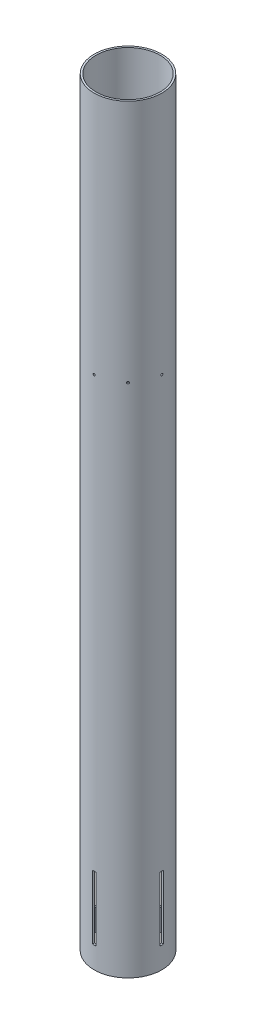
from build123d import *

# Parameters (mm, degrees)
SKETCH1_R                 = 53.721
SKETCH1_R_2               = 50.8
BODY_TUBE_EXTRUSION_DEPTH = 1206.5
ENGINE_BLOCK_HOLE_REACH   = 1214.465
SKETCH2_R                 = 1.6383
CIRPATTERN1_COUNT         = 8
CUT_EXTRUDE1_REACH        = 1214.465
SKETCH3_W                 = 5.334
SKETCH3_H                 = 101.6
CIRPATTERN2_COUNT         = 4


with BuildPart() as part:
    # Sketch1 → Body Tube Extrusion (new body)
    with BuildSketch(Plane(origin=(0, 0, 0), x_dir=(1, 0, 0), z_dir=(0, 1, 0))):
        Circle(SKETCH1_R)
        Circle(SKETCH1_R_2, mode=Mode.SUBTRACT)
    extrude(amount=BODY_TUBE_EXTRUSION_DEPTH)

    # Sketch2 → Engine Block Hole (cut, up to next)
    with BuildSketch(Plane.XY.offset(53.721), mode=Mode.PRIVATE) as engine_block_hole_sk1:
        with Locations((0, 819.15)):
            Circle(SKETCH2_R)
    engine_block_hole_tool1 = extrude(engine_block_hole_sk1.sketch, amount=-ENGINE_BLOCK_HOLE_REACH, mode=Mode.PRIVATE) & part.part
    engine_block_hole = engine_block_hole_tool1.solids().sort_by_distance((0, 819.15, 53.721))[0]
    add(engine_block_hole, mode=Mode.SUBTRACT)

    # CirPattern1: Engine Block Hole ×8 about axis
    cirpattern1_axis = Axis((0, 1206.5, 0), (0, -1, 0))
    for i in range(1, CIRPATTERN1_COUNT):
        add(engine_block_hole.rotate(cirpattern1_axis, i * 360 / CIRPATTERN1_COUNT), mode=Mode.SUBTRACT)

    # Sketch3 → Cut-Extrude1 (cut, up to next)
    with BuildSketch(Plane.XY.offset(53.721), mode=Mode.PRIVATE) as cut_extrude1_sk1:
        with Locations((0, 85.09)):
            Rectangle(SKETCH3_W, SKETCH3_H)
    cut_extrude1_tool1 = extrude(cut_extrude1_sk1.sketch, amount=-CUT_EXTRUDE1_REACH, mode=Mode.PRIVATE) & part.part
    cut_extrude1 = cut_extrude1_tool1.solids().sort_by_distance((0, 85.09, 53.721))[0]
    add(cut_extrude1, mode=Mode.SUBTRACT)

    # CirPattern2: Cut-Extrude1 ×4 about axis
    cirpattern2_axis = Axis((0, 1206.5, 0), (0, -1, 0))
    for i in range(1, CIRPATTERN2_COUNT):
        add(cut_extrude1.rotate(cirpattern2_axis, i * 360 / CIRPATTERN2_COUNT), mode=Mode.SUBTRACT)


solid = part.part
